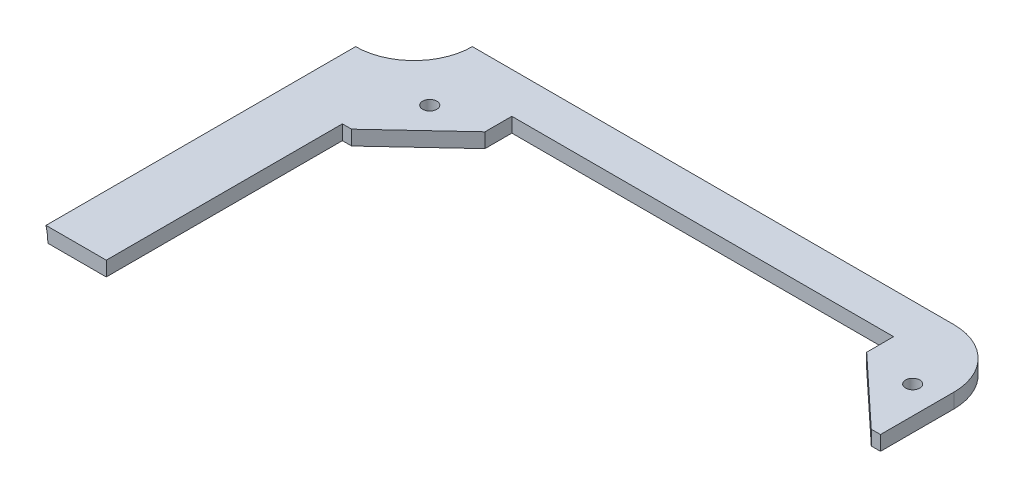
from build123d import *

# Parameters (mm, degrees)
SKETCH1_W            = 190.5
SKETCH1_H            = 76.2
BOSS_EXTRUDE1_DEPTH  = 3.175
SKETCH2_R            = 1.545336663
CUT_EXTRUDE4_DEPTH   = 103.636509708
SKETCH3_W            = 153.75
SKETCH3_H            = 3.175
BOSS_EXTRUDE2_DEPTH  = 3.81
CUT_SWEEP1_PROFILE_R = 12.7
CUT_EXTRUDE5_DEPTH   = 84.027454059
FILLET1_R            = 12.7


with BuildPart() as part:
    # Sketch1 → Boss-Extrude1 (new body)
    with BuildSketch(Plane(origin=(0, 0, 0), x_dir=(1, 0, 0), z_dir=(0, 1, 0))):
        Rectangle(SKETCH1_W, SKETCH1_H)
    extrude(amount=BOSS_EXTRUDE1_DEPTH)

    # Sketch2 → Cut-Extrude4 (cut, through all)
    with BuildSketch(Plane(origin=(0, 3.175, 0), x_dir=(1, 0, 0), z_dir=(0, 1, 0))):
        Polygon((-58.5, 13.235), (-58.5, -38.1), (95.25, -38.1), (95.25, 38.1), (58.5, 38.1), (58.5, 13.235), (56.5, 13.235), (41.5, 27.235), (41.5, 33.085), (-41.5, 33.085), (-41.5, 27.235), (-56.5, 13.235), align=None)
        with Locations((-52.505245516, 26.240245516)):
            Circle(SKETCH2_R)
        with Locations((52.5, 26.240245516)):
            Circle(SKETCH2_R)
    extrude(amount=-CUT_EXTRUDE4_DEPTH, mode=Mode.SUBTRACT)

    # Sketch3 → Boss-Extrude2 (add)
    with BuildSketch(Plane(origin=(0, 0, -38.1), x_dir=(-1, 0, 0), z_dir=(0, 0, -1))):
        with Locations((18.375, 1.5875)):
            Rectangle(SKETCH3_W, SKETCH3_H)
    extrude(amount=BOSS_EXTRUDE2_DEPTH)

    # Cut-Sweep1: sweep along a curve in space
    with BuildLine() as cut_sweep1_path:
        Line((-83.9, 0, -54.718912637), (-83.9, 0, 449.819630794))
    # Cut-Sweep1 profile (on start of the path) → Cut-Sweep1 (sweep, cut)
    with BuildSketch(Plane(origin=(-83.9, 0, -54.718912637), x_dir=(0, 1, 0), z_dir=(0, 0, 1))):
        Circle(CUT_SWEEP1_PROFILE_R)
    sweep(path=cut_sweep1_path.line, mode=Mode.SUBTRACT)

    # Sketch9 → Cut-Extrude5 (cut, through all)
    with BuildSketch(Plane(origin=(0, 3.175, 0), x_dir=(1, 0, 0), z_dir=(0, 1, 0))):
        with BuildLine():
            Line((-71.603277876, 29.21), (-71.603277876, 41.91))
            Line((-71.603277876, 41.91), (-58.903277876, 41.91))
            ThreePointArc((-58.903277876, 41.91), (-62.623021755, 32.929743879), (-71.603277876, 29.21))
        make_face()
    extrude(amount=-CUT_EXTRUDE5_DEPTH, mode=Mode.SUBTRACT)

    # Fillet1
    fillet1_edges = [part.edges().sort_by_distance(p)[0] for p in [
        (58.5, 1.5875, -41.91),
    ]]
    fillet(fillet1_edges, radius=FILLET1_R)


solid = part.part
